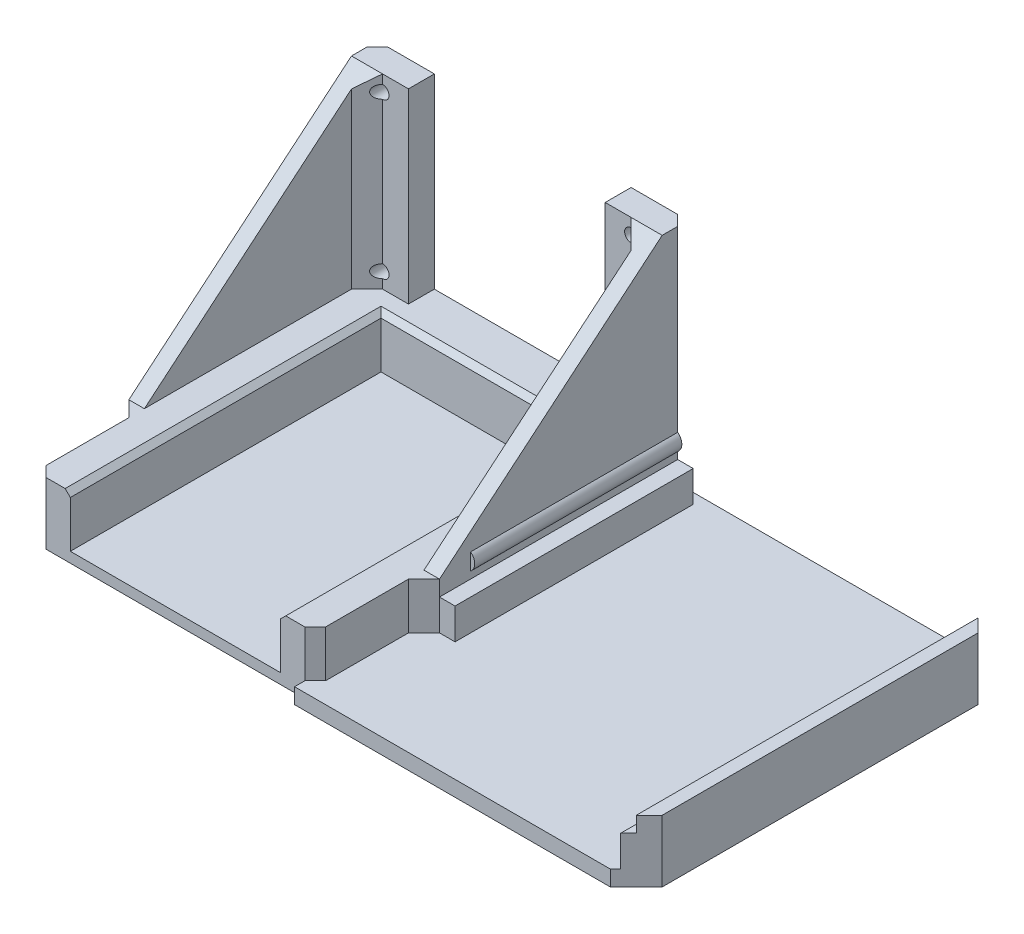
from build123d import *

# Parameters (mm, degrees)
SKETCH1_W             = 8
SKETCH1_H             = 36
SKETCH1_R             = 1.25
BOSS_EXTRUDE1_DEPTH   = 5
BOSS_EXTRUDE1_2_DEPTH = 5
SKETCH2_W             = 54
SKETCH2_H             = 5
BOSS_EXTRUDE2_DEPTH   = 12
SKETCH4_W             = 54
SKETCH4_H             = 12
BOSS_EXTRUDE3_DEPTH   = 64
SKETCH5_W             = 40.6
SKETCH5_H             = 60.5
CUT_EXTRUDE1_DEPTH    = 10
BOSS_EXTRUDE4_DEPTH   = 3
BOSS_EXTRUDE5_START   = -54
BOSS_EXTRUDE5_DEPTH   = 3
CHAMFER1_SIZE         = 2
CHAMFER2_SIZE         = 1
CHAMFER3_SIZE         = 3
SKETCH8_W             = 66
SKETCH8_H             = 71
BOSS_EXTRUDE6_DEPTH   = 3
SKETCH9_W             = 3
SKETCH9_H             = 46
SKETCH9_W_2           = 4
SKETCH9_H_2           = 71
BOSS_EXTRUDE7_DEPTH   = 6
BOSS_EXTRUDE8_DEPTH   = 40
SKETCH12_W            = 2.5
SKETCH12_H            = 71
BOSS_EXTRUDE9_DEPTH   = 3
CHAMFER4_SIZE         = 5


with BuildPart() as part:
    # Sketch1 → Boss-Extrude1 (new body)
    with BuildSketch(Plane.XY):
        with Locations((1, 15)):
            Rectangle(SKETCH1_W, SKETCH1_H)
        Circle(SKETCH1_R, mode=Mode.SUBTRACT)
        with Locations((0, 30)):
            Circle(SKETCH1_R, mode=Mode.SUBTRACT)
    extrude(amount=BOSS_EXTRUDE1_DEPTH)



with BuildPart() as body_2:
    # Sketch1 → Boss-Extrude1 2 (new body)
    with BuildSketch(Plane.XY):
        with Locations((47, 15)):
            Rectangle(SKETCH1_W, SKETCH1_H)
        with Locations((48, 0)):
            Circle(SKETCH1_R, mode=Mode.SUBTRACT)
        with Locations((48, 30)):
            Circle(SKETCH1_R, mode=Mode.SUBTRACT)
    extrude(amount=BOSS_EXTRUDE1_2_DEPTH)


with BuildPart() as part_1:
    add(part.part)

    add(body_2.part)  # Boss-Extrude2 merges body 2
    # Sketch2 → Boss-Extrude2 (add)
    with BuildSketch(Plane.XZ.offset(3)):
        with Locations((24, 2.5)):
            Rectangle(SKETCH2_W, SKETCH2_H)
    extrude(amount=BOSS_EXTRUDE2_DEPTH)

    # Sketch4 → Boss-Extrude3 (add)
    with BuildSketch(Plane.XY.offset(5)):
        with Locations((24, -9)):
            Rectangle(SKETCH4_W, SKETCH4_H)
    extrude(amount=BOSS_EXTRUDE3_DEPTH)

    # Sketch5 → Cut-Extrude1 (cut)
    with BuildSketch(Plane(origin=(0, -3, 0), x_dir=(1, 0, 0), z_dir=(0, 1, 0))):
        with Locations((24, -39.25)):
            Rectangle(SKETCH5_W, SKETCH5_H)
    extrude(amount=-CUT_EXTRUDE1_DEPTH, mode=Mode.SUBTRACT)

    # Sketch7 → Boss-Extrude4 (add)
    with BuildSketch(Plane.ZY.offset(3)):
        Polygon((0, 33), (0, -15), (48, -15), (48, -3), (5, 33), align=None)
    extrude(amount=BOSS_EXTRUDE4_DEPTH)

    # Sketch7<2> → Boss-Extrude5 (add)
    with BuildSketch(Plane.ZY.offset(3).offset(BOSS_EXTRUDE5_START)):
        Polygon((0, 33), (0, -15), (48, -15), (48, -3), (5, 33), align=None)
    extrude(amount=-BOSS_EXTRUDE5_DEPTH)

    # Chamfer1
    chamfer1_edges = [part_1.edges().sort_by_distance(p)[0] for p in [
        (-3, -9, 69),
        (51, -9, 69),
        (-6, 9, 0),
        (54, 9, 0),
    ]]
    chamfer(chamfer1_edges, length=CHAMFER1_SIZE)

    # Chamfer2
    chamfer2_edges = [part_1.edges().sort_by_distance(p)[0] for p in [
        (44.3, -3, 39),
        (24, -3, 9),
        (3.7, -3, 39),
    ]]
    chamfer(chamfer2_edges, length=CHAMFER2_SIZE)

    # Chamfer3
    # the kernel refuses this chamfer: 3 mm, written as the material it adds along each edge
    with BuildSketch(Plane(origin=(51, -15, 48), x_dir=(-0.027495876610584467, 0, 0.9996219169112969), z_dir=(0, 1, 0))) as chamfer3_piece_1_section:
        Polygon((CHAMFER3_SIZE * 0.999621916911, CHAMFER3_SIZE * 0.0274958766106), (-CHAMFER3_SIZE * 0.0274958766106, CHAMFER3_SIZE * 0.999621916911), (0, 0), align=None)
    chamfer3_piece_1 = extrude(amount=12, mode=Mode.PRIVATE)
    chamfer3_piece_1 = split(chamfer3_piece_1, bisect_by=Plane(origin=(54, -9.397887016, 48.948587344), z_dir=(-1, 0, 0)), keep=Keep.TOP, mode=Mode.PRIVATE)
    chamfer3_piece_1 = split(chamfer3_piece_1, bisect_by=Plane(origin=(52.008422093, -6.10336241, 51.70679399), z_dir=(0, -0.7667576729931039, -0.6419366564593428)), keep=Keep.TOP, mode=Mode.PRIVATE)
    add(chamfer3_piece_1)
    with BuildSketch(Plane(origin=(51, -15, 48), x_dir=(-0.027495876610584467, 0, 0.9996219169112969), z_dir=(0, 1, 0))) as chamfer3_piece_2_section:
        Polygon((CHAMFER3_SIZE * 0.999621916911, CHAMFER3_SIZE * 0.0274958766106), (-CHAMFER3_SIZE * 0.0274958766106, CHAMFER3_SIZE * 0.999621916911), (0, 0), align=None)
    chamfer3_piece_2 = extrude(amount=12, mode=Mode.PRIVATE)
    chamfer3_piece_2 = split(chamfer3_piece_2, bisect_by=Plane(origin=(51.683373084, -4.039508932, 49.241635668), z_dir=(0, 0.7667576729931039, 0.6419366564593428)), keep=Keep.TOP, mode=Mode.PRIVATE)
    add(chamfer3_piece_2)
    with BuildSketch(Plane(origin=(-3, -15, 48), x_dir=(0.027495876610586334, 0, 0.9996219169112968), z_dir=(0, 1, 0))) as chamfer3_piece_3_section:
        Polygon((CHAMFER3_SIZE * 0.999621916911, -CHAMFER3_SIZE * 0.0274958766106), (-CHAMFER3_SIZE * 0.0274958766106, -CHAMFER3_SIZE * 0.999621916911), (0, 0), align=None)
    chamfer3_piece_3 = extrude(amount=12, mode=Mode.PRIVATE)
    chamfer3_piece_3 = split(chamfer3_piece_3, bisect_by=Plane(origin=(-6, -9.397887016, 48.948587344), z_dir=(1, 0, 0)), keep=Keep.TOP, mode=Mode.PRIVATE)
    chamfer3_piece_3 = split(chamfer3_piece_3, bisect_by=Plane(origin=(-4.008422093, -6.10336241, 51.70679399), z_dir=(0, -0.7667576729931039, -0.6419366564593428)), keep=Keep.TOP, mode=Mode.PRIVATE)
    add(chamfer3_piece_3)
    with BuildSketch(Plane(origin=(-3, -15, 48), x_dir=(0.027495876610586334, 0, 0.9996219169112968), z_dir=(0, 1, 0))) as chamfer3_piece_4_section:
        Polygon((CHAMFER3_SIZE * 0.999621916911, -CHAMFER3_SIZE * 0.0274958766106), (-CHAMFER3_SIZE * 0.0274958766106, -CHAMFER3_SIZE * 0.999621916911), (0, 0), align=None)
    chamfer3_piece_4 = extrude(amount=12, mode=Mode.PRIVATE)
    chamfer3_piece_4 = split(chamfer3_piece_4, bisect_by=Plane(origin=(-3.683373084, -4.039508932, 49.241635668), z_dir=(0, 0.7667576729931039, 0.6419366564593428)), keep=Keep.TOP, mode=Mode.PRIVATE)
    add(chamfer3_piece_4)
    with BuildSketch(Plane(origin=(-3, 33, 5), x_dir=(-0.02749587661058635, 0, 0.9996219169112968), z_dir=(0, -1, 0))) as chamfer3_piece_5_section:
        Polygon((CHAMFER3_SIZE * 0.999621916911, -CHAMFER3_SIZE * 0.0274958766106), (-CHAMFER3_SIZE * 0.0274958766106, -CHAMFER3_SIZE * 0.999621916911), (0, 0), align=None)
    chamfer3_piece_5 = extrude(amount=43.715048964, mode=Mode.PRIVATE)
    chamfer3_piece_5 = split(chamfer3_piece_5, bisect_by=Plane(origin=(-2.02772284, 24.92424675, 14.646038604), z_dir=(0, -0.7667576729931039, -0.6419366564593428)), keep=Keep.TOP, mode=Mode.PRIVATE)
    chamfer3_piece_5 = chamfer3_piece_5 - Plane(origin=(0, 0, 5.988374144), x_dir=(1, 0, 0), z_dir=(0, 0, -1)) * Cylinder(1.25, 100, mode=Mode.PRIVATE)
    chamfer3_piece_5 = chamfer3_piece_5 - Plane(origin=(0, 30, 5.988374144), x_dir=(1, 0, 0), z_dir=(0, 0, -1)) * Cylinder(1.25, 100, mode=Mode.PRIVATE)
    add(chamfer3_piece_5)
    with BuildSketch(Plane(origin=(51, -10.715048964, 5), x_dir=(0.02749587661058678, 0, 0.9996219169112968), z_dir=(0, 1, 0))) as chamfer3_piece_6_section:
        Polygon((CHAMFER3_SIZE * 0.999621916911, -CHAMFER3_SIZE * 0.0274958766106), (-CHAMFER3_SIZE * 0.0274958766106, -CHAMFER3_SIZE * 0.999621916911), (0, 0), align=None)
    chamfer3_piece_6 = extrude(amount=43.715048964, mode=Mode.PRIVATE)
    chamfer3_piece_6 = split(chamfer3_piece_6, bisect_by=Plane(origin=(50.01061912, 16.088421834, 25.199940587), z_dir=(0, -0.7667576729931039, -0.6419366564593428)), keep=Keep.TOP, mode=Mode.PRIVATE)
    chamfer3_piece_6 = chamfer3_piece_6 - Plane(origin=(48, 0, 5.98938088), x_dir=(1, 0, 0), z_dir=(0, 0, -1)) * Cylinder(1.25, 100, mode=Mode.PRIVATE)
    chamfer3_piece_6 = chamfer3_piece_6 - Plane(origin=(48, 30, 5.98938088), x_dir=(1, 0, 0), z_dir=(0, 0, -1)) * Cylinder(1.25, 100, mode=Mode.PRIVATE)
    add(chamfer3_piece_6)

    # Sketch8 → Boss-Extrude6 (add)
    with BuildSketch(Plane.XZ.offset(15)):
        with Locations((82, 35.5)):
            Rectangle(SKETCH8_W, SKETCH8_H)
    extrude(amount=-BOSS_EXTRUDE6_DEPTH)

    # Sketch9 → Boss-Extrude7 (add)
    with BuildSketch(Plane(origin=(0, -12, 0), x_dir=(1, 0, 0), z_dir=(0, 1, 0))):
        with Locations((55.5, -25)):
            Rectangle(SKETCH9_W, SKETCH9_H)
        with Locations((113, -35.5)):
            Rectangle(SKETCH9_W_2, SKETCH9_H_2)
    extrude(amount=BOSS_EXTRUDE7_DEPTH)

    # Sketch11 → Boss-Extrude8 (add)
    with BuildSketch(Plane(origin=(0, 0, 2), x_dir=(-1, 0, 0), z_dir=(0, 0, -1))):
        with BuildLine():
            Line((-54, -1.45), (-54, -4.65))
            ThreePointArc((-54, -4.65), (-54.8, -3.05), (-54, -1.45))
        make_face()
    extrude(amount=-BOSS_EXTRUDE8_DEPTH)

    # Sketch12 → Boss-Extrude9 (add)
    with BuildSketch(Plane(origin=(0, -6, 0), x_dir=(1, 0, 0), z_dir=(0, 1, 0))):
        with Locations((113.75, -35.5)):
            Rectangle(SKETCH12_W, SKETCH12_H)
    extrude(amount=BOSS_EXTRUDE9_DEPTH)

    # Chamfer4
    # the kernel refuses this chamfer: 5 mm, written as the material it takes off along each edge
    with BuildSketch(Plane(origin=(115, -12, 0), x_dir=(-0.9996219169112968, 0, -0.027495876610586334), z_dir=(0, 1, 0))) as chamfer4_piece_1:
        Polygon((CHAMFER4_SIZE * 0.999621916911, CHAMFER4_SIZE * 0.0274958766106), (-CHAMFER4_SIZE * 0.0274958766106, CHAMFER4_SIZE * 0.999621916911), (0, 0), align=None)
    extrude(amount=6, mode=Mode.SUBTRACT)
    with BuildSketch(Plane(origin=(115, -12, 71), x_dir=(-0.9996219169112968, 0, 0.027495876610587663), z_dir=(0, 1, 0))) as chamfer4_piece_2:
        Polygon((CHAMFER4_SIZE * 0.999621916911, -CHAMFER4_SIZE * 0.0274958766106), (-CHAMFER4_SIZE * 0.0274958766106, -CHAMFER4_SIZE * 0.999621916911), (0, 0), align=None)
    extrude(amount=6, mode=Mode.SUBTRACT)
    with BuildSketch(Plane(origin=(115, -27.85841494, 71), x_dir=(-0.9996219169112968, 0, 0.027495876610587663), z_dir=(0, 1, 0)), Plane(origin=(115, -6, 71), x_dir=(-0.9996219169112968, 0, 0.027495876610587663), z_dir=(0, 1, 0))) as chamfer4_piece_3:
        Polygon((CHAMFER4_SIZE * 0.999621916911, -CHAMFER4_SIZE * 0.0274958766106), (-CHAMFER4_SIZE * 0.0274958766106, -CHAMFER4_SIZE * 0.999621916911), (0, 0), align=None)
    extrude(amount=15.85841494, mode=Mode.SUBTRACT)
    with BuildSketch(Plane(origin=(115, -27.85841494, 0), x_dir=(-0.9996219169112968, 0, -0.02749587661058646), z_dir=(0, 1, 0)), Plane(origin=(115, -6, 0), x_dir=(-0.9996219169112968, 0, -0.02749587661058634), z_dir=(0, 1, 0))) as chamfer4_piece_4:
        Polygon((CHAMFER4_SIZE * 0.999621916911, CHAMFER4_SIZE * 0.0274958766106), (-CHAMFER4_SIZE * 0.0274958766106, CHAMFER4_SIZE * 0.999621916911), (0, 0), align=None)
    extrude(amount=15.85841494, mode=Mode.SUBTRACT)


solid = part_1.part
